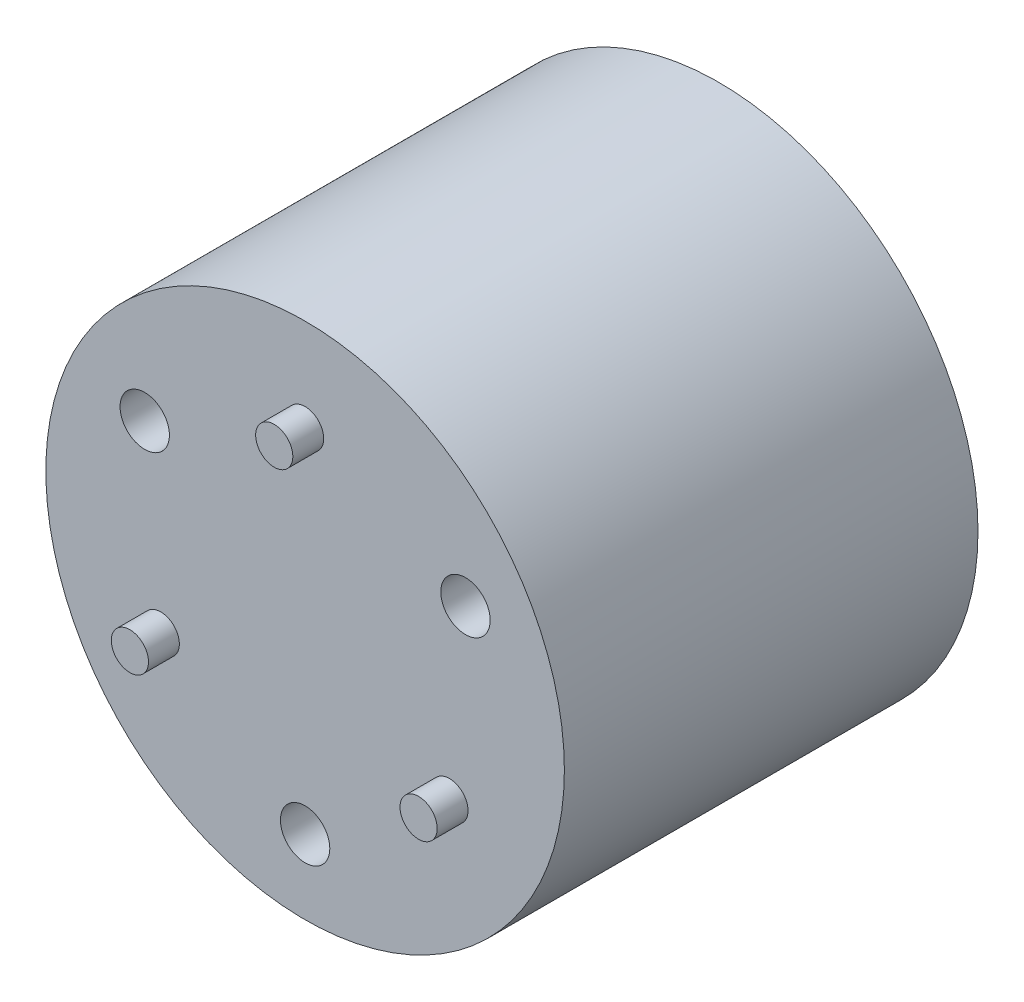
from build123d import *

# Parameters (mm, degrees)
SKETCH2_R           = 21
BOSS_EXTRUDE1_DEPTH = 33.5
SKETCH3_R           = 2
CUT_EXTRUDE2_DEPTH  = 4
SKETCH4_R           = 1.505859146
BOSS_EXTRUDE2_DEPTH = 2.5


with BuildPart() as part:
    # Sketch2 → Boss-Extrude1 (new body)
    with BuildSketch(Plane.XY):
        Circle(SKETCH2_R)
    extrude(amount=-BOSS_EXTRUDE1_DEPTH)

    # Sketch3 → Cut-Extrude2 (cut)
    with BuildSketch(Plane.XY):
        with Locations((0, -15)):
            Circle(SKETCH3_R)
        with Locations((-12.990381057, 7.5)):
            Circle(SKETCH3_R)
        with Locations((12.990381057, 7.5)):
            Circle(SKETCH3_R)
    extrude(amount=-CUT_EXTRUDE2_DEPTH, mode=Mode.SUBTRACT)

    # Sketch4 → Boss-Extrude2 (add)
    with BuildSketch(Plane.XY):
        with Locations((0, 13.5)):
            Circle(SKETCH4_R)
        with Locations((11.691342951, -6.75)):
            Circle(SKETCH4_R)
        with Locations((-11.691342951, -6.75)):
            Circle(SKETCH4_R)
    extrude(amount=BOSS_EXTRUDE2_DEPTH)


solid = part.part
